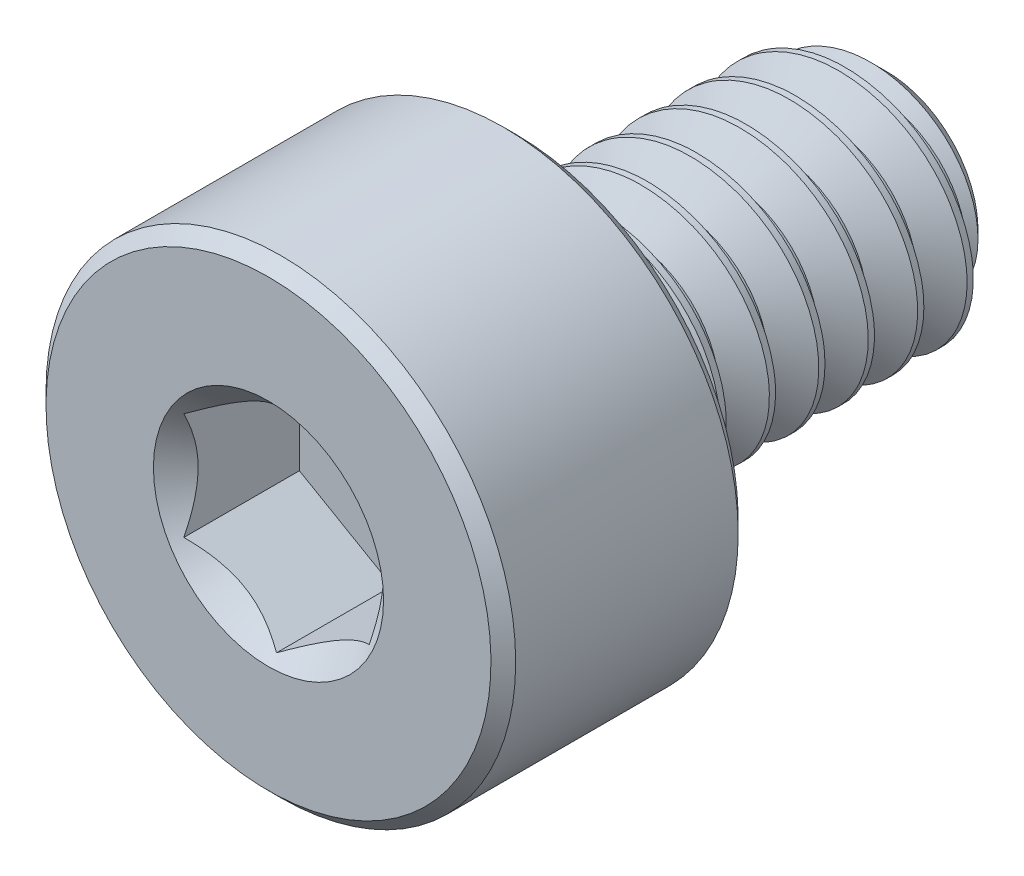
from build123d import *

# Parameters (mm, degrees)
CUT_EXTRUDE1_DEPTH     = 1
SPLIT1_SURFACE_1_BACK  = 8.34
SPLIT1_SURFACE_1_DEPTH = 16.68
SPLIT1_SURFACE_2_BACK  = 8.34
SPLIT1_SURFACE_2_DEPTH = 16.68
CUT_SWEEP1_PITCH       = 0.4


with BuildPart() as part:
    # Sketch2 → Revolve1 (revolve)
    with BuildSketch(Plane(origin=(0, 0, 0), x_dir=(0, 0, -1), z_dir=(1, 0, 0))):
        with BuildLine():
            Line((-2.5, 0), (-2.5, 1.8))
            Line((-2.5, 1.8), (-2.4, 1.9))
            Line((-2.4, 1.9), (-0.6, 1.9))
            Line((-0.6, 1.9), (-0.5, 1.8))
            Line((-0.5, 1.8), (-0.5, 1.1))
            ThreePointArc((-0.5, 1.1), (-0.470710678, 1.029289322), (-0.4, 1))
            Line((-0.4, 1), (2.240192379, 1))
            Line((2.240192379, 1), (2.5, 0.740192379))
            Line((2.5, 0.740192379), (2.5, 0))
            Line((2.5, 0), (-2.5, 0))
        make_face()
    revolve(axis=Axis((0, 0, -2.5), (0, 0, 1)))

    # Sketch3 → Cut-Extrude1 (cut)
    with BuildSketch(Plane.XY.offset(2.5)):
        Polygon((0.75, -0.433012702), (0.75, 0.433012702), (0, 0.866025404), (-0.75, 0.433012702), (-0.75, -0.433012702), (0, -0.866025404), align=None)
    extrude(amount=-CUT_EXTRUDE1_DEPTH, mode=Mode.SUBTRACT)

    # Cut-Extrude2 cone 1 section (through the dimple's axis) → Cut-Extrude2 (revolve, cut)
    with BuildSketch(Plane(origin=(0, 0, 2.5), x_dir=(0, -1, 0), z_dir=(1, 0, 0))):
        Polygon((0, 0), (0.930977309, 0), (0, 0.930977309), align=None)
    revolve(axis=Axis((0, 0, 2.5), (0, 0, -1)), mode=Mode.SUBTRACT)


with BuildPart() as body_2:
    # Split1: the piece behind the surface
    add(part.part)
    # Split1 surface: a surface, the sketch's curves swept straight by 16.68 mm
    with BuildLine(Plane(origin=(0, 0, 0), x_dir=(0, 0, -1), z_dir=(1, 0, 0)).offset(-SPLIT1_SURFACE_1_BACK), mode=Mode.PRIVATE) as split1_surface_1_path:
        Line((-0.4, -1.9), (-0.4, 1.9))
    split1_surface_1 = Shell.extrude(split1_surface_1_path.wire(), (1 * SPLIT1_SURFACE_1_DEPTH, 0 * SPLIT1_SURFACE_1_DEPTH, 0 * SPLIT1_SURFACE_1_DEPTH))
    split(bisect_by=split1_surface_1, keep=Keep.BOTTOM)

    # Cut-Sweep1: the profile of Sketch7 screwed along a right-hand helix of 8.5 turns, 6 arcs to a turn; built about Z, then put on its axis
    cut_sweep1_z = Axis((0, 0, 0), (0, 0, 1))
    cut_sweep1_corners = [(1.021650635, 0, 0.0125), (1.021650635, 0, -0.3625), (0.740192379, 0, -0.2), (0.740192379, 0, -0.15)]
    with BuildLine(mode=Mode.PRIVATE) as cut_sweep1_profile:
        Line(cut_sweep1_corners[0], cut_sweep1_corners[1])
        Line(cut_sweep1_corners[1], cut_sweep1_corners[2])
        Line(cut_sweep1_corners[2], cut_sweep1_corners[3])
        Line(cut_sweep1_corners[3], cut_sweep1_corners[0])
    cut_sweep1_cap = Face(cut_sweep1_profile.wire())
    cut_sweep1_turn_angles = [0, 30, 60, 90, 120, 150, 180, 210, 240, 270, 300, 330, 360]
    cut_sweep1_turn_weights = [1, 0.8660254037844387, 1, 0.8660254037844387, 1, 0.8660254037844387, 1, 0.8660254037844387, 1, 0.8660254037844387, 1, 0.8660254037844387, 1]
    cut_sweep1_turn_rails = [Edge.make_bspline([Vector(p[0], p[1], 0).rotate(cut_sweep1_z, cut_sweep1_turn_angles[k]) / cut_sweep1_turn_weights[k] + Vector(0, 0, p[2] + CUT_SWEEP1_PITCH * cut_sweep1_turn_angles[k] / 360) for k in range(13)], [0, 0, 0, 1, 1, 2, 2, 3, 3, 4, 4, 5, 5, 6, 6, 6], 2, cut_sweep1_turn_weights) for p in cut_sweep1_corners]
    cut_sweep1_turn_sides = [Face.make_surface_from_curves(cut_sweep1_turn_rails[p[0]], cut_sweep1_turn_rails[p[1]]) for p in [(0, 1), (1, 2), (2, 3), (3, 0)]]
    cut_sweep1_turn = Solid(Shell([*cut_sweep1_turn_sides, cut_sweep1_cap, cut_sweep1_cap.rotate(cut_sweep1_z, 360).moved(Location((0, 0, CUT_SWEEP1_PITCH * 360 / 360)))]))
    cut_sweep1_last_angles = [2880, 2910, 2940, 2970, 3000, 3030, 3060]
    cut_sweep1_last_weights = [1, 0.8660254037844387, 1, 0.8660254037844387, 1, 0.8660254037844287, 1]
    cut_sweep1_last_rails = [Edge.make_bspline([Vector(p[0], p[1], 0).rotate(cut_sweep1_z, cut_sweep1_last_angles[k]) / cut_sweep1_last_weights[k] + Vector(0, 0, p[2] + CUT_SWEEP1_PITCH * cut_sweep1_last_angles[k] / 360) for k in range(7)], [0, 0, 0, 1, 1, 2, 2, 3, 3, 3], 2, cut_sweep1_last_weights) for p in cut_sweep1_corners]
    cut_sweep1_last_sides = [Face.make_surface_from_curves(cut_sweep1_last_rails[p[0]], cut_sweep1_last_rails[p[1]]) for p in [(0, 1), (1, 2), (2, 3), (3, 0)]]
    cut_sweep1_last = Solid(Shell([*cut_sweep1_last_sides, cut_sweep1_cap.rotate(cut_sweep1_z, 2880).moved(Location((0, 0, CUT_SWEEP1_PITCH * 2880 / 360))), cut_sweep1_cap.rotate(cut_sweep1_z, 3060).moved(Location((0, 0, CUT_SWEEP1_PITCH * 3060 / 360)))]))
    cut_sweep1_each = [*[cut_sweep1_turn.moved(Location((0, 0, CUT_SWEEP1_PITCH * i))) for i in range(8)], cut_sweep1_last]
    add(Plane(origin=(0, 0, -2.5), x_dir=(0, 1, 0), z_dir=(0, 0, 1)) * Compound([cut_sweep1_each[i] for i in range(0, 9, 2)]), mode=Mode.SUBTRACT)
    add(Plane(origin=(0, 0, -2.5), x_dir=(0, 1, 0), z_dir=(0, 0, 1)) * Compound([cut_sweep1_each[i] for i in range(1, 9, 2)]), mode=Mode.SUBTRACT)


with BuildPart() as part_1:
    add(part.part)

    # Split1: split by a surface, the side it looks to stays
    # Split1 surface: a surface, the sketch's curves swept straight by 16.68 mm
    with BuildLine(Plane(origin=(0, 0, 0), x_dir=(0, 0, -1), z_dir=(1, 0, 0)).offset(-SPLIT1_SURFACE_2_BACK), mode=Mode.PRIVATE) as split1_surface_2_path:
        Line((-0.4, -1.9), (-0.4, 1.9))
    split1_surface_2 = Shell.extrude(split1_surface_2_path.wire(), (1 * SPLIT1_SURFACE_2_DEPTH, 0 * SPLIT1_SURFACE_2_DEPTH, 0 * SPLIT1_SURFACE_2_DEPTH))
    split(bisect_by=split1_surface_2, keep=Keep.TOP)

    add(body_2.part)  # Revolve2 merges body 2
    # Sketch8 → Revolve2 (revolve)
    with BuildSketch(Plane(origin=(0, 0, 0), x_dir=(0, 0, -1), z_dir=(1, 0, 0)), mode=Mode.PRIVATE) as revolve2_sk:
        Polygon((-0.5, 0), (-0.5, 1), (-0.4, 1), (0.177350269, 0), align=None)
    revolve(revolve2_sk.sketch.rotate(Axis((0, 0, -0.177350269), (0, 0, 1)), 270), axis=Axis((0, 0, -0.177350269), (0, 0, 1)))


solid = part_1.part
